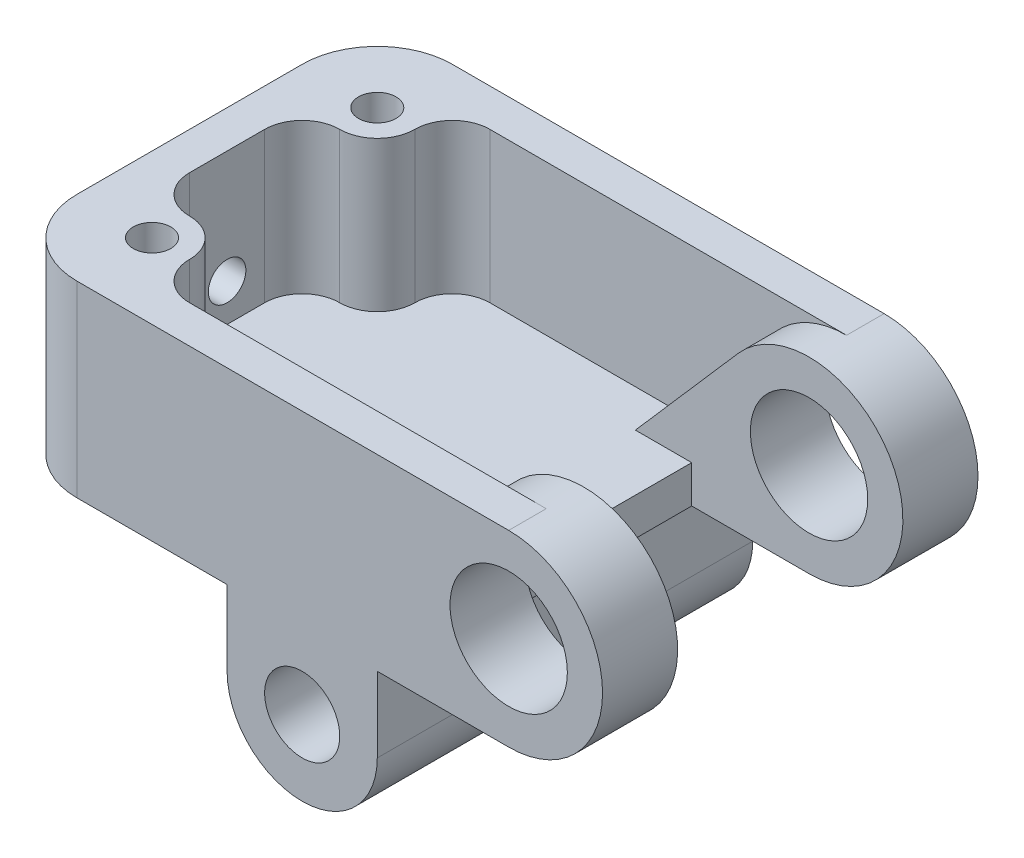
from build123d import *
from build123d.topology import SkipClean

# Parameters (mm, degrees)
SKETCH1_R           = 8
BOSS_EXTRUDE1_DEPTH = 40
SKETCH2_W           = 45
SKETCH2_H           = 64
CUT_EXTRUDE1_DEPTH  = 80
FILLET1_R           = 20
HOLE1_D             = 25
FILLET2_R           = 16
HOLE2_D             = 8
CUT_EXTRUDE2_DEPTH  = 32
SKETCH8_R           = 12.5
BOSS_EXTRUDE2_DEPTH = 8
BOSS_EXTRUDE3_DEPTH = 8
HOLE3_D             = 8


with BuildPart() as part:
    # Sketch1 → Boss-Extrude1 (new, symmetric)
    with BuildSketch(Plane.XY):
        with BuildLine():
            Line((48, -16), (48, 0))
            Line((48, 0), (0, 0))
            Line((0, 0), (0, 40))
            Line((0, 40), (128, 40))
            Line((128, 40), (128, 0))
            Line((128, 0), (80, 0))
            Line((80, 0), (80, -16))
            ThreePointArc((80, -16), (64, -32), (48, -16))
        make_face()
        with Locations((64, -16)):
            Circle(SKETCH1_R, mode=Mode.SUBTRACT)
    extrude(amount=BOSS_EXTRUDE1_DEPTH, both=True)

    # Sketch2 → Cut-Extrude1 (cut)
    with BuildSketch(Plane(origin=(0, 40, 0), x_dir=(1, 0, 0), z_dir=(0, 1, 0))):
        with Locations((105.5, 0)):
            Rectangle(SKETCH2_W, SKETCH2_H)
    extrude(amount=-CUT_EXTRUDE1_DEPTH, mode=Mode.SUBTRACT)

    # Fillet1
    fillet1_edges = [part.edges().sort_by_distance(p)[0] for p in [
        (128, 0, 36),
        (128, 0, -36),
        (128, 40, -36),
        (128, 40, 36),
    ]]
    fillet(fillet1_edges, radius=FILLET1_R - 0.0001)  # a hair under: the kernel refuses the full size

    # Hole1 (through all)
    with Locations(Plane.XY.offset(40)):
        with Locations((108, 20)):
            Hole(HOLE1_D / 2)

    # Fillet2
    fillet2_edges = [part.edges().sort_by_distance(p)[0] for p in [
        (0, 20, -40),
        (0, 20, 40),
    ]]
    fillet(fillet2_edges, radius=FILLET2_R)

    # Hole2 (through all)
    with Locations(Plane(origin=(0, 40, 0), x_dir=(1, 0, 0), z_dir=(0, 1, 0))):
        with Locations((16, 24), (16, -24)):
            Hole(HOLE2_D / 2)

    # Sketch7 → Cut-Extrude2 (cut)
    with BuildSketch(Plane(origin=(0, 40, 0), x_dir=(1, 0, 0), z_dir=(0, 1, 0))):
        with BuildLine():
            Line((8, -8), (8, 8))
            ThreePointArc((8, 8), (10.343145751, 13.656854249), (16, 16))
            ThreePointArc((16, 16), (21.656854249, 18.343145751), (24, 24))
            ThreePointArc((24, 24), (26.343145751, 29.656854249), (32, 32))
            Line((32, 32), (83, 32))
            Line((83, 32), (83, -32))
            Line((83, -32), (32, -32))
            ThreePointArc((32, -32), (26.343145751, -29.656854249), (24, -24))
            ThreePointArc((24, -24), (21.656854249, -18.343145751), (16, -16))
            ThreePointArc((16, -16), (10.343145751, -13.656854249), (8, -8))
        make_face()
    extrude(amount=-CUT_EXTRUDE2_DEPTH, mode=Mode.SUBTRACT)

    # Sketch8 → Boss-Extrude2 (add)
    with SkipClean():  # the faces are left unmerged after this step: merging them gives an invalid solid
        with BuildSketch(Plane.XY.offset(-32)):
            with BuildLine():
                Line((83, 8), (71, 8))
                Line((71, 8), (92.926108981, 33.14449731))
                ThreePointArc((92.926108981, 33.14449731), (126.205630258, 28.279796308), (108, 0))
                Line((108, 0), (83, 0))
                Line((83, 0), (83, 8))
            make_face()
            with Locations((108, 20)):
                Circle(SKETCH8_R, mode=Mode.SUBTRACT)
        boss_extrude2 = extrude(amount=BOSS_EXTRUDE2_DEPTH)
    add(part.part.scale(1), mode=Mode.REPLACE)  # the faces are merged on a copy

    # Mirror1: Boss-Extrude2 across plane
    add(boss_extrude2.mirror(Plane.XY))

    # Sketch9 → Boss-Extrude3 (add)
    with BuildSketch(Plane.ZY):
        with BuildLine():
            Line((-16, 16), (-16, 0))
            Line((-16, 0), (16, 0))
            Line((16, 0), (16, 16))
            ThreePointArc((16, 16), (0, 32), (-16, 16))
        make_face()
    extrude(amount=BOSS_EXTRUDE3_DEPTH)

    # Hole3 (through all)
    with Locations(Plane.ZY.offset(8)):
        with Locations((0, 16)):
            Hole(HOLE3_D / 2)


solid = part.part
